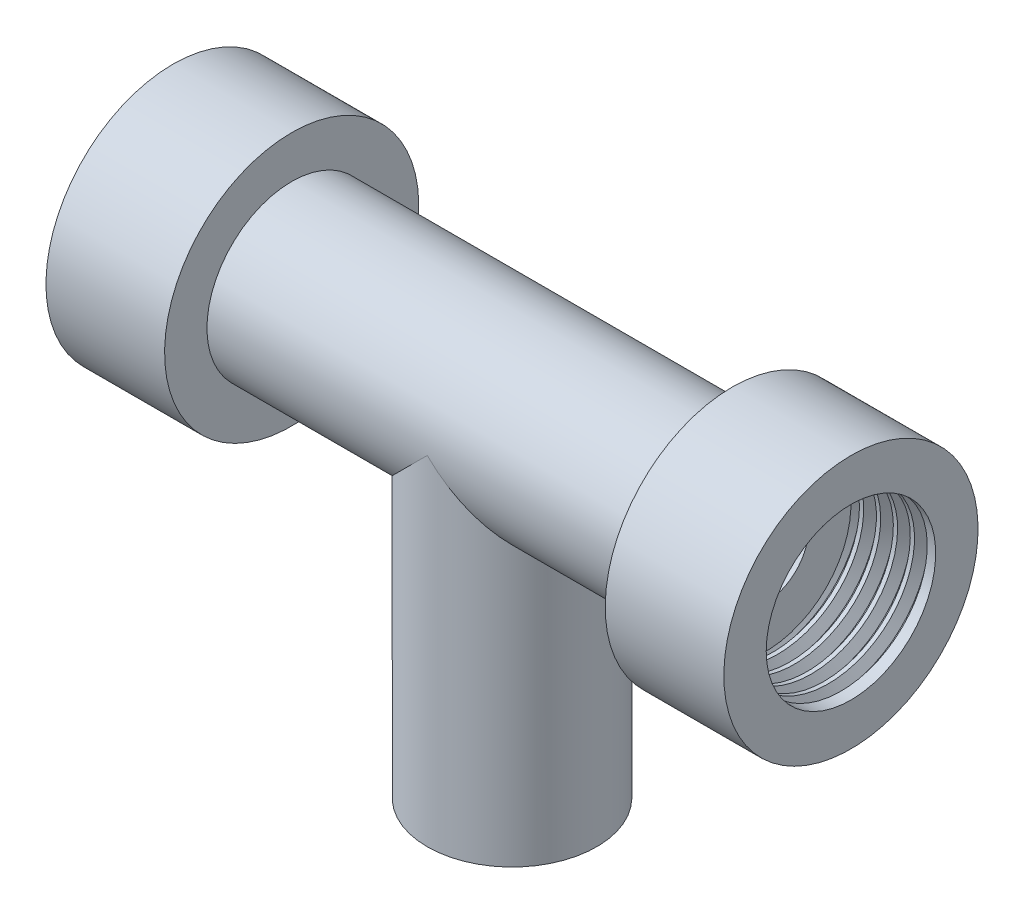
from build123d import *

# Parameters (mm, degrees)
SKETCH1_W          = 6.35
SKETCH1_H          = 25.4
SKETCH3_R          = 3.175
CUT_EXTRUDE1_DEPTH = 25.4
SKETCH4_R          = 3.175
CUT_EXTRUDE2_DEPTH = 38.1
THREAD1_PITCH      = 1.27
THREAD2_PITCH      = 1.27


with BuildPart() as part:
    # Sketch1 → Revolve1 (revolve)
    with BuildSketch(Plane.XY, mode=Mode.PRIVATE) as revolve1_sk:
        with Locations((3.175, -12.7)):
            Rectangle(SKETCH1_W, SKETCH1_H)
    revolve(revolve1_sk.sketch.rotate(Axis((0, 0, 0), (0, -1, 0)), 90), axis=Axis((0, 0, 0), (0, -1, 0)))

    # Sketch2 → Revolve2 (revolve)
    with BuildSketch(Plane.XY, mode=Mode.PRIVATE) as revolve2_sk:
        Polygon((0, 0), (0, -6.35), (16.51, -6.35), (16.51, -9.525), (25.4, -9.525), (25.4, -6.35), (19.05, -6.35), (19.05, 0), align=None)
    revolve2 = revolve(revolve2_sk.sketch.rotate(Axis((19.05, 0, 0), (-1, 0, 0)), 180), axis=Axis((19.05, 0, 0), (-1, 0, 0)))

    # Mirror1: Revolve2 across plane
    add(revolve2.mirror(Plane(origin=(0, 0, 0), x_dir=(0, 0, 1), z_dir=(1, 0, 0))))

    # Sketch3 → Cut-Extrude1 (cut)
    with BuildSketch(Plane.XZ.offset(25.4)):
        with Locations(Location((0, 0, 0), (0, 0, 270))):
            Circle(SKETCH3_R)
    extrude(amount=-CUT_EXTRUDE1_DEPTH, mode=Mode.SUBTRACT)

    # Sketch4 → Cut-Extrude2 (cut)
    with BuildSketch(Plane.ZY.offset(19.05)):
        with Locations(Location((0, 0, 0), (0, 0, 270))):
            Circle(SKETCH4_R)
    extrude(amount=-CUT_EXTRUDE2_DEPTH, mode=Mode.SUBTRACT)

    # Thread1: the profile of Thread Profile1 profile screwed along a right-hand helix of 5 turns, 8 arcs to a turn; built about Z, then put on its axis
    thread1_z = Axis((0, 0, 0), (0, 0, 1))
    thread1_corners = [(6.3497, 0, -0.000173205), (7.037407661, 0, 0.396874998), (7.037407661, 0, 0.555624998), (6.3497, 0, 0.952673202)]
    with BuildLine(mode=Mode.PRIVATE) as thread1_profile:
        Line(thread1_corners[0], thread1_corners[1])
        Line(thread1_corners[1], thread1_corners[2])
        Line(thread1_corners[2], thread1_corners[3])
        Line(thread1_corners[3], thread1_corners[0])
    thread1_cap = Face(thread1_profile.wire())
    thread1_turn_angles = [0, 22.5, 45, 67.5, 90, 112.5, 135, 157.5, 180, 202.5, 225, 247.5, 270, 292.5, 315, 337.5, 360]
    thread1_turn_weights = [1, 0.9238795325112867, 1, 0.9238795325112867, 1, 0.9238795325112867, 1, 0.9238795325112867, 1, 0.9238795325112867, 1, 0.9238795325112867, 1, 0.9238795325112867, 1, 0.9238795325112867, 1]
    thread1_turn_rails = [Edge.make_bspline([Vector(p[0], p[1], 0).rotate(thread1_z, thread1_turn_angles[k]) / thread1_turn_weights[k] + Vector(0, 0, p[2] + THREAD1_PITCH * thread1_turn_angles[k] / 360) for k in range(17)], [0, 0, 0, 1, 1, 2, 2, 3, 3, 4, 4, 5, 5, 6, 6, 7, 7, 8, 8, 8], 2, thread1_turn_weights) for p in thread1_corners]
    thread1_turn_sides = [Face.make_surface_from_curves(thread1_turn_rails[p[0]], thread1_turn_rails[p[1]]) for p in [(0, 1), (1, 2), (2, 3), (3, 0)]]
    thread1 = Plane(origin=(25.4, 0, 0), x_dir=(0, 0, 1), z_dir=(-1, 0, 0)) * Solid(Shell([*[p.moved(Location((0, 0, THREAD1_PITCH * i))) for i in range(5) for p in thread1_turn_sides], thread1_cap, thread1_cap.rotate(thread1_z, 1800).moved(Location((0, 0, THREAD1_PITCH * 1800 / 360)))]))
    add(thread1, mode=Mode.SUBTRACT)

    # Thread2: the profile of Thread Profile2 profile screwed along a right-hand helix of 5 turns, 8 arcs to a turn; built about Z, then put on its axis
    thread2_z = Axis((0, 0, 0), (0, 0, 1))
    thread2_corners = [(6.3497, 0, -0.000173205), (7.037407661, 0, 0.396874998), (7.037407661, 0, 0.555624998), (6.3497, 0, 0.952673202)]
    with BuildLine(mode=Mode.PRIVATE) as thread2_profile:
        Line(thread2_corners[0], thread2_corners[1])
        Line(thread2_corners[1], thread2_corners[2])
        Line(thread2_corners[2], thread2_corners[3])
        Line(thread2_corners[3], thread2_corners[0])
    thread2_cap = Face(thread2_profile.wire())
    thread2_turn_angles = [0, 22.5, 45, 67.5, 90, 112.5, 135, 157.5, 180, 202.5, 225, 247.5, 270, 292.5, 315, 337.5, 360]
    thread2_turn_weights = [1, 0.9238795325112867, 1, 0.9238795325112867, 1, 0.9238795325112867, 1, 0.9238795325112867, 1, 0.9238795325112867, 1, 0.9238795325112867, 1, 0.9238795325112867, 1, 0.9238795325112867, 1]
    thread2_turn_rails = [Edge.make_bspline([Vector(p[0], p[1], 0).rotate(thread2_z, thread2_turn_angles[k]) / thread2_turn_weights[k] + Vector(0, 0, p[2] + THREAD2_PITCH * thread2_turn_angles[k] / 360) for k in range(17)], [0, 0, 0, 1, 1, 2, 2, 3, 3, 4, 4, 5, 5, 6, 6, 7, 7, 8, 8, 8], 2, thread2_turn_weights) for p in thread2_corners]
    thread2_turn_sides = [Face.make_surface_from_curves(thread2_turn_rails[p[0]], thread2_turn_rails[p[1]]) for p in [(0, 1), (1, 2), (2, 3), (3, 0)]]
    thread2 = Plane(origin=(-25.4, 0, 0), x_dir=(0, 0, -1), z_dir=(1, 0, 0)) * Solid(Shell([*[p.moved(Location((0, 0, THREAD2_PITCH * i))) for i in range(5) for p in thread2_turn_sides], thread2_cap, thread2_cap.rotate(thread2_z, 1800).moved(Location((0, 0, THREAD2_PITCH * 1800 / 360)))]))
    add(thread2, mode=Mode.SUBTRACT)


solid = part.part
